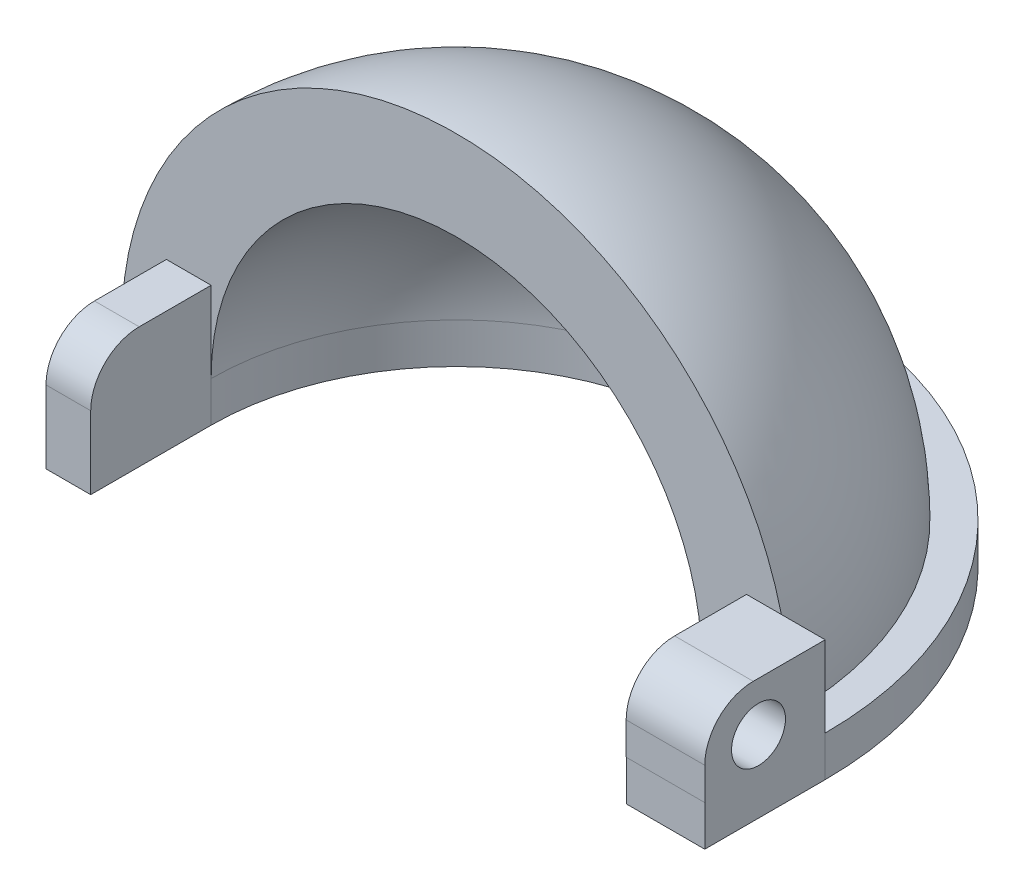
from build123d import *

# Parameters (mm, degrees)
BOSS_EXTRUDE2_DEPTH = 2.54
REVOLVE1_ANGLE      = 90
SKETCH8_W           = 4.942667085
SKETCH8_H           = 7.570002741
BOSS_EXTRUDE6_DEPTH = 5.08
SKETCH9_W           = 4.999318902
SKETCH9_H           = 7.570002741
BOSS_EXTRUDE7_DEPTH = 5.08
FILLET8_R           = 3.048
FILLET9_R           = 3.048
SKETCH33_R          = 1.695511812
CUT_EXTRUDE1_DEPTH  = 50.546
SKETCH34_W          = 2.811975891
SKETCH34_H          = 2.54
CUT_EXTRUDE2_DEPTH  = 7.62
SKETCH35_W          = 2.832955299
SKETCH35_H          = 2.54
CUT_EXTRUDE3_DEPTH  = 7.62
SKETCH36_W          = 2.811975891
SKETCH36_H          = 7.62
BOSS_EXTRUDE9_DEPTH = 7.62
SKETCH39_W          = 4.999318902
SKETCH39_H          = 7.570002741
CUT_EXTRUDE4_DEPTH  = 7.62
FILLET10_R          = 3.048


with BuildPart() as part:
    # Sketch1 → Boss-Extrude2 (new body)
    with BuildSketch(Plane(origin=(0, 0, 0), x_dir=(1, 0, 0), z_dir=(0, 1, 0))):
        with BuildLine():
            Line((0, 0), (0, -7.570002741))
            Line((0, -7.570002741), (7.811294793, -7.570002741))
            Line((7.811294793, -7.570002741), (7.811294793, 0))
            ThreePointArc((7.811294793, 0), (23.238051165, 15.426756373), (38.664807538, 0))
            Line((38.664807538, 0), (38.664807538, -7.570002741))
            Line((38.664807538, -7.570002741), (46.419938239, -7.570002741))
            Line((46.419938239, -7.570002741), (46.419938239, 0))
            ThreePointArc((46.419938239, 0), (23.20996912, 23.20996912), (0, 0))
        make_face()
    extrude(amount=BOSS_EXTRUDE2_DEPTH)

    # Sketch2 → Revolve1 (revolve)
    with BuildSketch(Plane(origin=(0, 2.54, 0), x_dir=(1, 0, 0), z_dir=(0, 1, 0))):
        with BuildLine():
            Line((2.187343011, 0), (7.811294793, 0))
            ThreePointArc((7.811294793, 0), (23.238051165, 15.426756373), (38.664807538, 0))
            Line((38.664807538, 0), (44.28973477, 0))
            ThreePointArc((44.28973477, 0), (23.238538891, 21.051195879), (2.187343011, 0))
        make_face()
    revolve(axis=Axis((38.664807538, 2.54, 0), (1, 0, 0)), revolution_arc=REVOLVE1_ANGLE)

    # Sketch8 → Boss-Extrude6 (add)
    with BuildSketch(Plane(origin=(0, 2.54, 0), x_dir=(1, 0, 0), z_dir=(0, 1, 0))):
        with Locations((43.948604696, -3.785001371)):
            Rectangle(SKETCH8_W, SKETCH8_H)
    extrude(amount=BOSS_EXTRUDE6_DEPTH)

    # Sketch9 → Boss-Extrude7 (add)
    with BuildSketch(Plane(origin=(0, 2.54, 0), x_dir=(1, 0, 0), z_dir=(0, 1, 0))):
        with Locations((2.499659451, -3.785001371)):
            Rectangle(SKETCH9_W, SKETCH9_H)
    extrude(amount=BOSS_EXTRUDE7_DEPTH)

    # Fillet8
    fillet8_edges = [part.edges().sort_by_distance(p)[0] for p in [
        (43.948604697, 7.62, 7.570002741),
    ]]
    fillet(fillet8_edges, radius=FILLET8_R)

    # Fillet9
    fillet9_edges = [part.edges().sort_by_distance(p)[0] for p in [
        (2.499659451, 7.62, 7.570002741),
    ]]
    fillet(fillet9_edges, radius=FILLET9_R)

    # Sketch33 → Cut-Extrude1 (cut)
    with BuildSketch(Plane(origin=(46.419938239, 0, 0), x_dir=(0, 0, -1), z_dir=(1, 0, 0))):
        with Locations((-4.192218668, 4.560325148)):
            Circle(SKETCH33_R)
    extrude(amount=-CUT_EXTRUDE1_DEPTH, mode=Mode.SUBTRACT)

    # Sketch34 → Cut-Extrude2 (cut)
    with BuildSketch(Plane.XY.offset(7.570002741)):
        with Locations((6.405306848, 1.27)):
            Rectangle(SKETCH34_W, SKETCH34_H)
    extrude(amount=-CUT_EXTRUDE2_DEPTH, mode=Mode.SUBTRACT)

    # Sketch35 → Cut-Extrude3 (cut)
    with BuildSketch(Plane.XY.offset(7.570002741)):
        with Locations((40.081285188, 1.27)):
            Rectangle(SKETCH35_W, SKETCH35_H)
    extrude(amount=-CUT_EXTRUDE3_DEPTH, mode=Mode.SUBTRACT)

    # Sketch36 → Boss-Extrude9 (add)
    with BuildSketch(Plane.XY.offset(-0.049997259)):
        with Locations((6.405306848, 3.81)):
            Rectangle(SKETCH36_W, SKETCH36_H)
    extrude(amount=BOSS_EXTRUDE9_DEPTH)

    # Sketch39 → Cut-Extrude4 (cut)
    with BuildSketch(Plane(origin=(0, 7.62, 0), x_dir=(1, 0, 0), z_dir=(0, 1, 0))):
        with Locations((2.499659451, -3.785001371)):
            Rectangle(SKETCH39_W, SKETCH39_H)
    extrude(amount=-CUT_EXTRUDE4_DEPTH, mode=Mode.SUBTRACT)

    # Fillet10
    fillet10_edges = [part.edges().sort_by_distance(p)[0] for p in [
        (6.405306847, 7.62, 7.570002741),
    ]]
    fillet(fillet10_edges, radius=FILLET10_R)


solid = part.part
